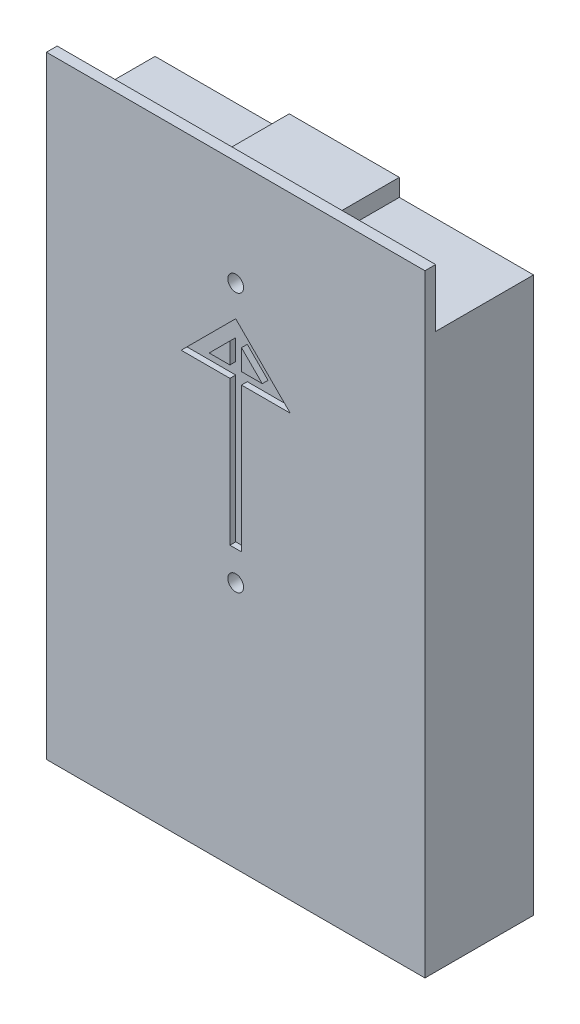
from build123d import *

# Parameters (mm, degrees)
SKETCH1_W               = 65.35
SKETCH1_H               = 95.75
BOSS_EXTRUDE1_DEPTH     = 18.75
SKETCH2_R               = 1.36
CUT_EXTRUDE1_DEPTH      = 61.919896175
CUT_EXTRUDE_THIN1_START = -1
CUT_EXTRUDE_THIN1_DEPTH = 1
SKETCH5_W               = 19
SKETCH5_H               = 3
BOSS_EXTRUDE2_DEPTH     = 18.75
BOSS_EXTRUDE3_DEPTH     = 1.85


# Read off the part's stored shape, not the designer's step: Cut-Extrude-Thin1
with BuildPart() as part:
    # Sketch1 → Boss-Extrude1 (new body)
    with BuildSketch(Plane.XY):
        Rectangle(SKETCH1_W, SKETCH1_H)
    extrude(amount=BOSS_EXTRUDE1_DEPTH)

    # Sketch2 → Cut-Extrude1 (cut, through all)
    with BuildSketch(Plane.XY.offset(18.75)):
        with Locations((0, 39.675)):
            Circle(SKETCH2_R)
        with Locations((0, -5.125)):
            Circle(SKETCH2_R)
    extrude(amount=-CUT_EXTRUDE1_DEPTH, mode=Mode.SUBTRACT)

    # Cut-Extrude-Thin1 outline → Cut-Extrude-Thin1 (cut)
    with BuildSketch(Plane.XY.offset(18.75).offset(CUT_EXTRUDE_THIN1_START)):
        Polygon((1, 0), (1, 24.947040452), (9.414099592, 24.947040452), (0, 34.361140044), (-9.414099592, 24.947040452), (-1, 24.947040452), (-1, 0), align=None)
        Polygon((-4.585672467, 26.947040452), (-1, 30.532712919), (-1, 26.947040452), align=None, mode=Mode.SUBTRACT)
        Polygon((1, 26.947040452), (1, 30.532712919), (4.585672467, 26.947040452), align=None, mode=Mode.SUBTRACT)
    extrude(amount=CUT_EXTRUDE_THIN1_DEPTH, mode=Mode.SUBTRACT)

    # Sketch5 → Boss-Extrude2 (add)
    with BuildSketch(Plane.XY.offset(18.75)):
        with Locations((0, 49.375)):
            Rectangle(SKETCH5_W, SKETCH5_H)
    extrude(amount=-BOSS_EXTRUDE2_DEPTH)

    # Sketch6 → Boss-Extrude3 (add)
    with BuildSketch(Plane.XY.offset(18.75)):
        Polygon((-32.675, 57.875), (32.675, 57.875), (32.675, 47.875), (9.5, 47.875), (9.5, 50.875), (-9.5, 50.875), (-9.5, 47.875), (-32.675, 47.875), align=None)
    extrude(amount=-BOSS_EXTRUDE3_DEPTH)


solid = part.part
